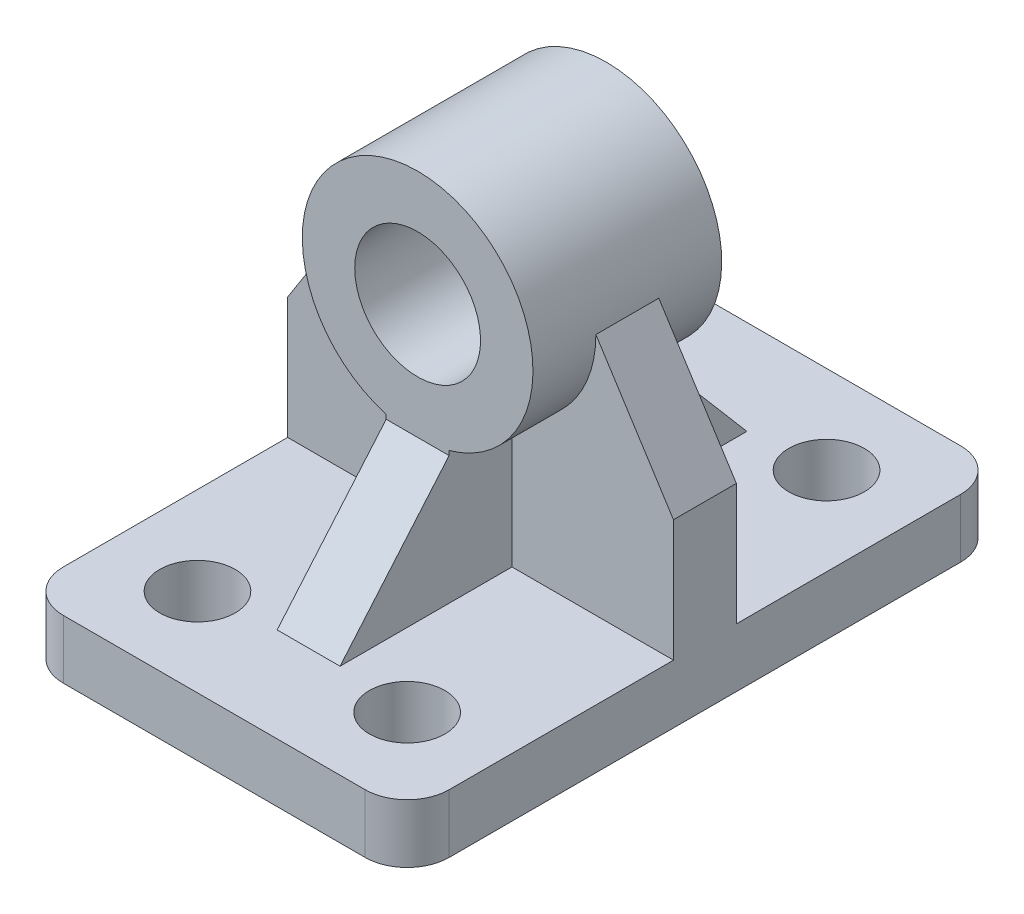
from build123d import *

# Parameters (mm, degrees)
ESQUISSE1_W        = 92
ESQUISSE1_H        = 142
ESQUISSE1_R        = 9
BOSS_EXTRU_1_DEPTH = 14
CONG_1_R           = 10
ESQUISSE2_R        = 27.5
ESQUISSE2_R_2      = 15
BOSS_EXTRU_2_DEPTH = 22.5
BOSS_EXTRU_3_DEPTH = 7.5
NERVURE1_START     = -7.5
NERVURE1_DEPTH     = 15


with BuildPart() as part:
    # Esquisse1 → Boss.-Extru.1 (new body)
    with BuildSketch(Plane(origin=(0, 0, 0), x_dir=(1, 0, 0), z_dir=(0, 1, 0))):
        Rectangle(ESQUISSE1_W, ESQUISSE1_H)
        with Locations(Location((25, -50, 0), (0, 0, 270))):
            Circle(ESQUISSE1_R, mode=Mode.SUBTRACT)
        with Locations(Location((25, 50, 0), (0, 0, 90))):
            Circle(ESQUISSE1_R, mode=Mode.SUBTRACT)
        with Locations(Location((-25, -50, 0), (0, 0, 90))):
            Circle(ESQUISSE1_R, mode=Mode.SUBTRACT)
        with Locations(Location((-25, 50, 0), (0, 0, 270))):
            Circle(ESQUISSE1_R, mode=Mode.SUBTRACT)
    extrude(amount=BOSS_EXTRU_1_DEPTH)

    # Congé1
    cong_1_edges = [part.edges().sort_by_distance(p)[0] for p in [
        (46, 7, 71),
        (-46, 7, 71),
        (-46, 7, -71),
        (46, 7, -71),
    ]]
    fillet(cong_1_edges, radius=CONG_1_R)



with BuildPart() as body_2:
    # Esquisse2 → Boss.-Extru.2 (new, symmetric)
    with BuildSketch(Plane.XY):
        with Locations(Location((0, 72, 0), (0, 0, 180))):
            Circle(ESQUISSE2_R)
        with Locations(Location((0, 72, 0), (0, 0, 180))):
            Circle(ESQUISSE2_R_2, mode=Mode.SUBTRACT)
    extrude(amount=BOSS_EXTRU_2_DEPTH, both=True)


with BuildPart() as part_1:
    add(part.part)

    add(body_2.part)  # Boss.-Extru.3 merges body 2
    # Esquisse3 → Boss.-Extru.3 (add, symmetric)
    with BuildSketch(Plane.XY):
        with BuildLine():
            Line((46, 14), (46, 43))
            Line((46, 43), (27.5, 72))
            ThreePointArc((27.5, 72), (0, 44.5), (-27.5, 72))
            Line((-27.5, 72), (-46, 43))
            Line((-46, 43), (-46, 14))
            Line((-46, 14), (46, 14))
        make_face()
    extrude(amount=BOSS_EXTRU_3_DEPTH, both=True)

    # Nervure1: read off the stored shape, not the designer's step
    # Nervure1 outline → Nervure1 (add)
    with BuildSketch(Plane(origin=(0, 0, 0), x_dir=(0, 0, -1), z_dir=(1, 0, 0)).offset(NERVURE1_START)):
        Polygon((-22.5, 44.5), (-48.5, 14), (-7.5, 14), (-7.5, 45.542486889), (-22.5, 45.542486889), align=None)
    nervure1 = extrude(amount=NERVURE1_DEPTH)

    # Symétrie1: Nervure1 across plane
    add(nervure1.mirror(Plane.XY))


solid = part_1.part
